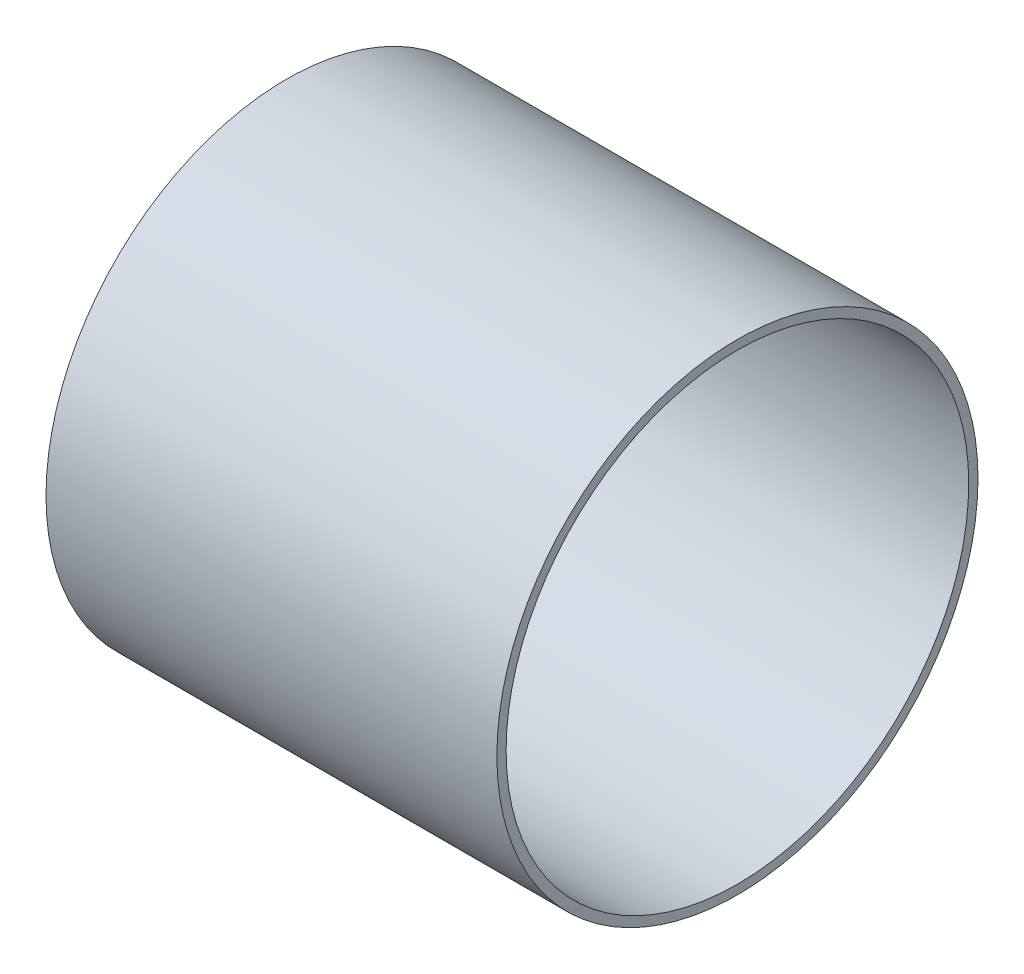
from build123d import *

# Parameters (mm, degrees)
THICKEN1_START       = -250
THICKEN1_OUTLINE_R   = 78
THICKEN1_OUTLINE_R_2 = 75
THICKEN1_DEPTH       = 146.187827941


# Read off the part's stored shape, not the designer's step: Thicken1
with BuildPart() as part:
    # Thicken1 outline → Thicken1 (new body)
    with BuildSketch(Plane.YZ.offset(THICKEN1_START)):
        Circle(THICKEN1_OUTLINE_R)
        Circle(THICKEN1_OUTLINE_R_2, mode=Mode.SUBTRACT)
    extrude(amount=THICKEN1_DEPTH)


solid = part.part
